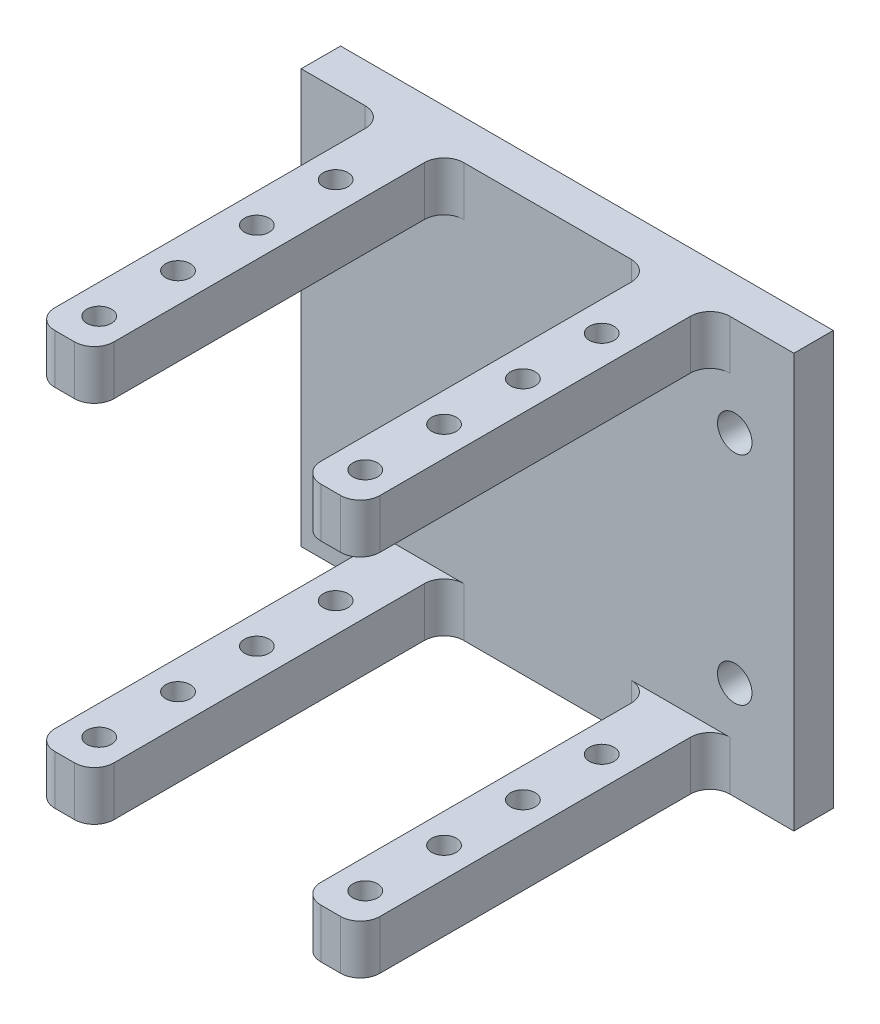
from build123d import *

# Parameters (mm, degrees)
ESQUISSE1_W             = 50
ESQUISSE1_H             = 42
ESQUISSE1_R             = 1.75
BOSS_EXTRU_1_DEPTH      = 4
ESQUISSE2_W             = 6
ESQUISSE2_H             = 5
BOSS_EXTRU_2_DEPTH      = 35.5
ESQUISSE3_R             = 1.25
ENL_V_MAT_EXTRU_1_DEPTH = 63.843058487
CONG_1_R                = 2


with BuildPart() as part:
    # Esquisse1 → Boss.-Extru.1 (new body)
    with BuildSketch(Plane.XY):
        Rectangle(ESQUISSE1_W, ESQUISSE1_H)
        with Locations((-19, 11)):
            Circle(ESQUISSE1_R, mode=Mode.SUBTRACT)
        with Locations((19, 11)):
            Circle(ESQUISSE1_R, mode=Mode.SUBTRACT)
        with Locations((19, -11)):
            Circle(ESQUISSE1_R, mode=Mode.SUBTRACT)
        with Locations((-19, -11)):
            Circle(ESQUISSE1_R, mode=Mode.SUBTRACT)
    extrude(amount=BOSS_EXTRU_1_DEPTH)

    # Esquisse2 → Boss.-Extru.2 (add)
    with BuildSketch(Plane.XY.offset(4)):
        with Locations((-13.5, 18.5)):
            Rectangle(ESQUISSE2_W, ESQUISSE2_H)
        with Locations((13.5, 18.5)):
            Rectangle(ESQUISSE2_W, ESQUISSE2_H)
        with Locations((-13.5, -18.5)):
            Rectangle(ESQUISSE2_W, ESQUISSE2_H)
        with Locations((13.5, -18.5)):
            Rectangle(ESQUISSE2_W, ESQUISSE2_H)
    extrude(amount=BOSS_EXTRU_2_DEPTH)

    # Esquisse3 → Enlèv. mat.-Extru.1 (cut, through all)
    with BuildSketch(Plane(origin=(0, 21, 0), x_dir=(1, 0, 0), z_dir=(0, 1, 0))):
        with Locations((-13.5, -12)):
            Circle(ESQUISSE3_R)
        with Locations((-13.5, -20)):
            Circle(ESQUISSE3_R)
        with Locations((-13.5, -28)):
            Circle(ESQUISSE3_R)
        with Locations((-13.5, -36)):
            Circle(ESQUISSE3_R)
        with Locations((13.5, -36)):
            Circle(ESQUISSE3_R)
        with Locations((13.5, -28)):
            Circle(ESQUISSE3_R)
        with Locations((13.5, -20)):
            Circle(ESQUISSE3_R)
        with Locations((13.5, -12)):
            Circle(ESQUISSE3_R)
    extrude(amount=-ENL_V_MAT_EXTRU_1_DEPTH, mode=Mode.SUBTRACT)

    # Congé1
    cong_1_edges = [part.edges().sort_by_distance(p)[0] for p in [
        (-16.5, -18.5, 39.5),
        (-16.5, 18.5, 39.5),
        (16.5, -18.5, 39.5),
        (16.5, 18.5, 39.5),
        (10.5, -18.5, 4),
        (16.5, -18.5, 4),
        (-10.5, -18.5, 4),
        (-16.5, -18.5, 4),
        (-16.5, 18.5, 4),
        (-10.5, 18.5, 4),
        (10.5, 18.5, 4),
        (16.5, 18.5, 4),
        (-10.5, -18.5, 39.5),
        (10.5, -18.5, 39.5),
        (10.5, 18.5, 39.5),
        (-10.5, 18.5, 39.5),
    ]]
    fillet(cong_1_edges, radius=CONG_1_R)


solid = part.part
